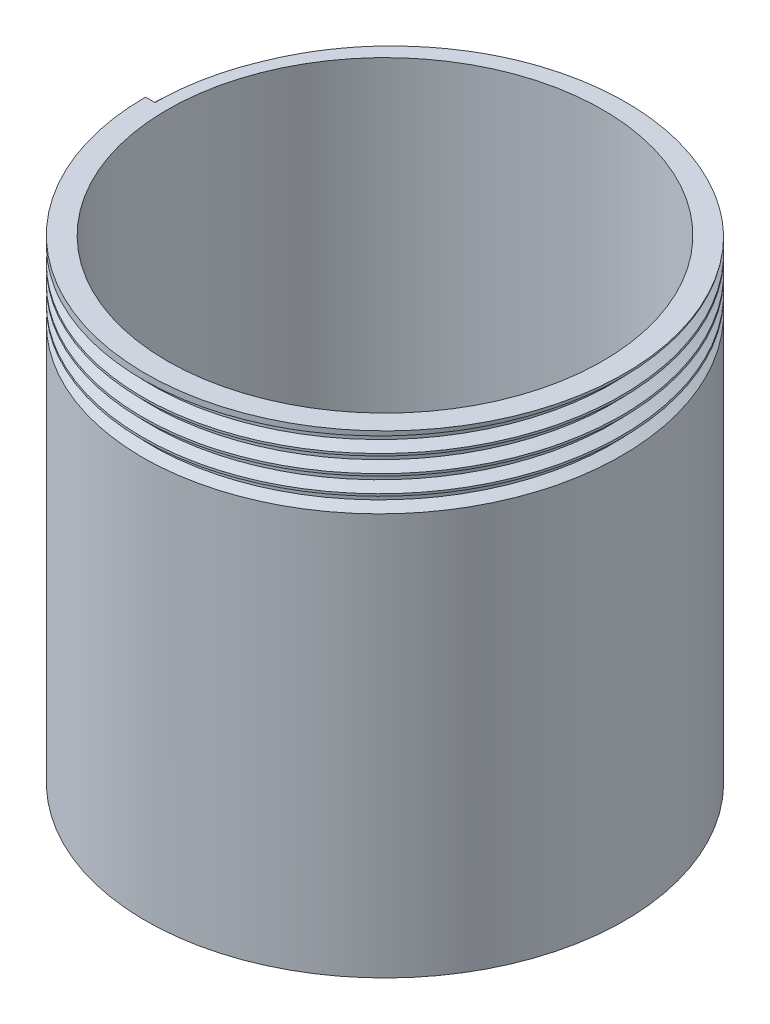
from build123d import *

# Parameters (mm, degrees)
SKETCH1_R           = 55
SKETCH1_R_2         = 50
BOSS_EXTRUDE1_DEPTH = 100
SKETCH14_R          = 2.5
CUT_EXTRUDE4_DEPTH  = 2
CUT_EXTRUDE5_DEPTH  = 1.5
THREAD1_PITCH       = 4
SKETCH21_W          = 2.5
SKETCH21_H          = 4.1
CUT_EXTRUDE7_DEPTH  = 134.757234799


with BuildPart() as part:
    # Sketch1 → Boss-Extrude1 (new body)
    with BuildSketch(Plane(origin=(0, 0, 0), x_dir=(1, 0, 0), z_dir=(0, 1, 0))):
        with Locations(Location((0, 0, 0), (0, 0, 270))):
            Circle(SKETCH1_R)
        with Locations(Location((0, 0, 0), (0, 0, 270))):
            Circle(SKETCH1_R_2, mode=Mode.SUBTRACT)
    extrude(amount=BOSS_EXTRUDE1_DEPTH)

    # Sketch3 → Revolve1 (revolve)
    with BuildSketch(Plane.XY):
        Polygon((-37.723688551, 0), (-55, 0), (-55, -8.816349035), (-5, -8.816349035), (0, -8.816349035), (0, -4.535780335), (0, -1.035780335), (-12, -1.035780335), align=None)
    revolve(axis=Axis((0, 0, 0), (0, -1, 0)))

    # Sketch14 → Cut-Extrude4 (cut)
    with BuildSketch(Plane.XZ.offset(8.816349035)):
        Circle(SKETCH14_R)
    extrude(amount=-CUT_EXTRUDE4_DEPTH, mode=Mode.SUBTRACT)

    # Sketch15 → Cut-Extrude5 (cut, symmetric)
    with BuildSketch(Plane(origin=(0, 0, 0), x_dir=(0, 0, -1), z_dir=(1, 0, 0))):
        with BuildLine():
            Line((-2, -8.816349035), (-9.101728284, -6.585959081))
            ThreePointArc((-9.101728284, -6.585959081), (-10.521338647, -4.124890186), (-8.18843067, -2.503257038))
            Line((-8.18843067, -2.503257038), (-2.371093082, -3.298404569))
            Line((-2.371093082, -3.298404569), (-2.371093082, 0))
            Line((-2.371093082, 0), (2.371093082, 0))
            Line((2.371093082, 0), (2.371093082, -3.298404569))
            Line((2.371093082, -3.298404569), (8.18843067, -2.503257038))
            ThreePointArc((8.18843067, -2.503257038), (10.521338647, -4.124890186), (9.101728284, -6.585959081))
            Line((9.101728284, -6.585959081), (2, -8.816349035))
            Line((2, -8.816349035), (2, -6.816349035))
            Line((2, -6.816349035), (8.604130574, -5.084162627))
            ThreePointArc((8.604130574, -5.084162627), (8.978140112, -4.469927682), (8.377805995, -4.073989996))
            Line((8.377805995, -4.073989996), (0, -5.635751759))
            Line((0, -5.635751759), (-8.377805995, -4.073989996))
            ThreePointArc((-8.377805995, -4.073989996), (-8.978140112, -4.469927682), (-8.604130574, -5.084162627))
            Line((-8.604130574, -5.084162627), (-2, -6.816349035))
            Line((-2, -6.816349035), (-2, -8.816349035))
        make_face()
    extrude(amount=CUT_EXTRUDE5_DEPTH, both=True, mode=Mode.SUBTRACT)

    # Thread1: arcs per turn and ends read off the stored shape
    # Thread1: the profile of Thread Profile1 profile screwed along a right-hand helix through 4.125 turns, 12 arcs to a turn; built about Z, then put on its axis
    thread1_z = Axis((0, 0, 0), (0, 0, 1))
    thread1_corners = [(55.0003, 0, -0.000173205), (55.0003, 0, 3.500173194), (52.8349365, 0, 2.249999995), (52.8349365, 0, 1.249999995)]
    with BuildLine(mode=Mode.PRIVATE) as thread1_profile:
        Line(thread1_corners[0], thread1_corners[1])
        Line(thread1_corners[1], thread1_corners[2])
        Line(thread1_corners[2], thread1_corners[3])
        Line(thread1_corners[3], thread1_corners[0])
    thread1_cap = Face(thread1_profile.wire())
    thread1_turn_angles = [0, 15, 30, 45, 60, 75, 90, 105, 120, 135, 150, 165, 180, 195, 210, 225, 240, 255, 270, 285, 300, 315, 330, 345, 360]
    thread1_turn_weights = [1, 0.9659258262890683, 1, 0.9659258262890683, 1, 0.9659258262890683, 1, 0.9659258262890683, 1, 0.9659258262890683, 1, 0.9659258262890683, 1, 0.9659258262890683, 1, 0.9659258262890683, 1, 0.9659258262890683, 1, 0.9659258262890683, 1, 0.9659258262890683, 1, 0.9659258262890683, 1]
    thread1_turn_rails = [Edge.make_bspline([Vector(p[0], p[1], 0).rotate(thread1_z, thread1_turn_angles[k]) / thread1_turn_weights[k] + Vector(0, 0, p[2] + THREAD1_PITCH * thread1_turn_angles[k] / 360) for k in range(25)], [0, 0, 0, 1, 1, 2, 2, 3, 3, 4, 4, 5, 5, 6, 6, 7, 7, 8, 8, 9, 9, 10, 10, 11, 11, 12, 12, 12], 2, thread1_turn_weights) for p in thread1_corners]
    thread1_turn_sides = [Face.make_surface_from_curves(thread1_turn_rails[p[0]], thread1_turn_rails[p[1]]) for p in [(0, 1), (1, 2), (2, 3), (3, 0)]]
    thread1_last_angles = [1440, 1455, 1470, 1477.5, 1485]
    thread1_last_weights = [1, 0.9659258262890683, 1, 0.9914448613738104, 1]
    thread1_last_rails = [Edge.make_bspline([Vector(p[0], p[1], 0).rotate(thread1_z, thread1_last_angles[k]) / thread1_last_weights[k] + Vector(0, 0, p[2] + THREAD1_PITCH * thread1_last_angles[k] / 360) for k in range(5)], [0, 0, 0, 1, 1, 2, 2, 2], 2, thread1_last_weights) for p in thread1_corners]
    thread1_last_sides = [Face.make_surface_from_curves(thread1_last_rails[p[0]], thread1_last_rails[p[1]]) for p in [(0, 1), (1, 2), (2, 3), (3, 0)]]
    thread1 = Plane(origin=(0, 101.5, 0), x_dir=(-1, 0, 0), z_dir=(0, -1, 0)) * Solid(Shell([*[p.moved(Location((0, 0, THREAD1_PITCH * i))) for i in range(4) for p in thread1_turn_sides], *thread1_last_sides, thread1_cap, thread1_cap.rotate(thread1_z, 1485).moved(Location((0, 0, THREAD1_PITCH * 1485 / 360)))]))
    add(thread1, mode=Mode.SUBTRACT)

    # Sketch21 → Cut-Extrude7 (cut, through all)
    with BuildSketch(Plane.XZ.offset(8.816349035)):
        with Locations((-9.75, 0)):
            Rectangle(SKETCH21_W, SKETCH21_H)
        with Locations((9.75, 0)):
            Rectangle(SKETCH21_W, SKETCH21_H)
    extrude(amount=-CUT_EXTRUDE7_DEPTH, mode=Mode.SUBTRACT)


solid = part.part
